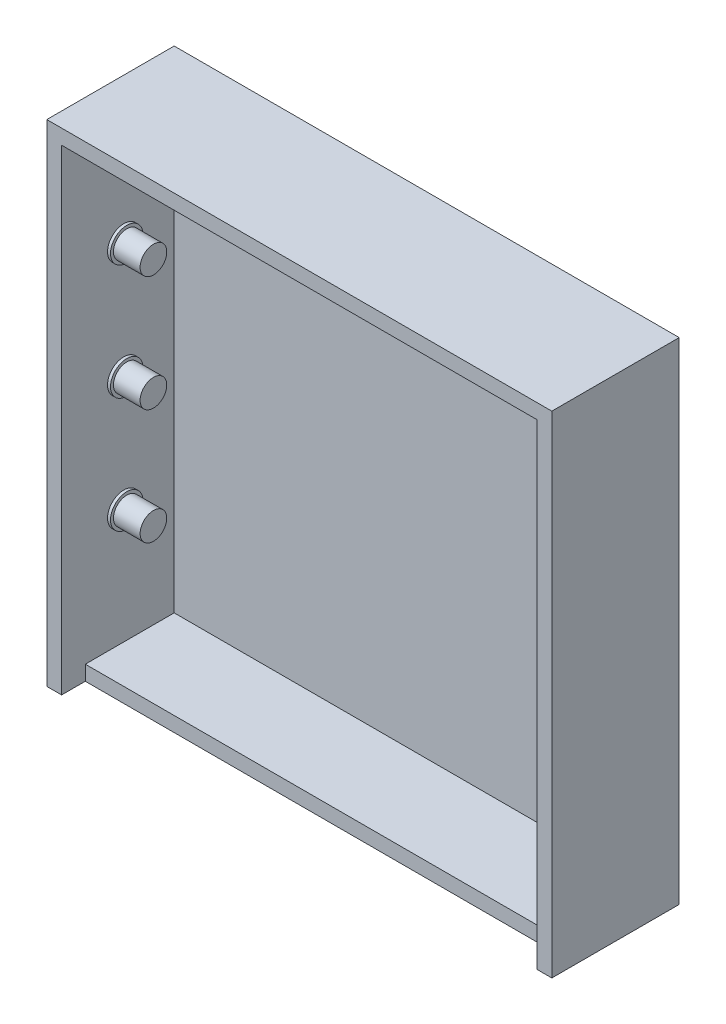
from build123d import *

# Parameters (mm, degrees)
SKETCH1_W               = 170.47
SKETCH1_H               = 165.71
BOSS_EXTRUDE1_DEPTH     = 5
SKETCH2_W               = 170.47
SKETCH2_H               = 165.71
SKETCH2_W_2             = 160.47
SKETCH2_H_2             = 155.71
BOSS_EXTRUDE2_DEPTH     = 38
SKETCH3_W               = 160.47
SKETCH3_H               = 5
CUT_EXTRUDE1_DEPTH      = 8
SKETCH5_R               = 5.5
BOSS_EXTRUDE3_DEPTH     = 1
SKETCH6_R               = 4.5
BOSS_EXTRUDE4_DEPTH     = 9
LPATTERN1_COUNT         = 3
LPATTERN1_PITCH         = 38.9275
MIRROR1_COPY_1_SKETCH_R = 5.5
MIRROR1_COPY_1_DEPTH    = 1
MIRROR1_COPY_2_SKETCH_R = 5.5
MIRROR1_COPY_2_DEPTH    = 1
MIRROR1_COPY_3_SKETCH_R = 4.5
MIRROR1_COPY_3_DEPTH    = 9
MIRROR1_COPY_4_SKETCH_R = 4.5
MIRROR1_COPY_4_DEPTH    = 9
MIRROR1_COPY_5_SKETCH_R = 5.5
MIRROR1_COPY_5_DEPTH    = 1
MIRROR1_COPY_6_SKETCH_R = 4.5
MIRROR1_COPY_6_DEPTH    = 9


with BuildPart() as part:
    # Sketch1 → Boss-Extrude1 (new body)
    with BuildSketch(Plane.XY):
        with Locations((85.235, 82.855)):
            Rectangle(SKETCH1_W, SKETCH1_H)
    extrude(amount=BOSS_EXTRUDE1_DEPTH)

    # Sketch2 → Boss-Extrude2 (add)
    with BuildSketch(Plane.XY.offset(5)):
        with Locations((85.235, 82.855)):
            Rectangle(SKETCH2_W, SKETCH2_H)
        with Locations((85.235, 82.855)):
            Rectangle(SKETCH2_W_2, SKETCH2_H_2, mode=Mode.SUBTRACT)
    extrude(amount=BOSS_EXTRUDE2_DEPTH)

    # Sketch3 → Cut-Extrude1 (cut)
    with BuildSketch(Plane.XY.offset(43)):
        with Locations((85.235, 2.5)):
            Rectangle(SKETCH3_W, SKETCH3_H)
    extrude(amount=-CUT_EXTRUDE1_DEPTH, mode=Mode.SUBTRACT)

    # Sketch5 → Boss-Extrude3 (add)
    with BuildSketch(Plane.ZY.offset(-165.47)):
        with Locations((22, 121.7825)):
            Circle(SKETCH5_R)
    boss_extrude3 = extrude(amount=BOSS_EXTRUDE3_DEPTH)

    # Sketch6 → Boss-Extrude4 (add)
    with BuildSketch(Plane.ZY.offset(-164.47)):
        with Locations((22, 121.7825)):
            Circle(SKETCH6_R)
    boss_extrude4 = extrude(amount=BOSS_EXTRUDE4_DEPTH)

    # LPattern1: Boss-Extrude3, Boss-Extrude4 ×3
    with Locations(*[(0, -i * LPATTERN1_PITCH, 0) for i in range(1, LPATTERN1_COUNT)]):
        add(boss_extrude3)
        add(boss_extrude4)

    # Mirror1 copy 1 sketch → Mirror1 copy 1 (add)
    with BuildSketch(Plane(origin=(5, -38.9275, 0), x_dir=(0, 0, 1), z_dir=(1, 0, 0))):
        with Locations((22, -121.7825)):
            Circle(MIRROR1_COPY_1_SKETCH_R)
    extrude(amount=MIRROR1_COPY_1_DEPTH)

    # Mirror1 copy 2 sketch → Mirror1 copy 2 (add)
    with BuildSketch(Plane(origin=(5, -77.855, 0), x_dir=(0, 0, 1), z_dir=(1, 0, 0))):
        with Locations((22, -121.7825)):
            Circle(MIRROR1_COPY_2_SKETCH_R)
    extrude(amount=MIRROR1_COPY_2_DEPTH)

    # Mirror1 copy 3 sketch → Mirror1 copy 3 (add)
    with BuildSketch(Plane(origin=(6, -38.9275, 0), x_dir=(0, 0, 1), z_dir=(1, 0, 0))):
        with Locations((22, -121.7825)):
            Circle(MIRROR1_COPY_3_SKETCH_R)
    extrude(amount=MIRROR1_COPY_3_DEPTH)

    # Mirror1 copy 4 sketch → Mirror1 copy 4 (add)
    with BuildSketch(Plane(origin=(6, -77.855, 0), x_dir=(0, 0, 1), z_dir=(1, 0, 0))):
        with Locations((22, -121.7825)):
            Circle(MIRROR1_COPY_4_SKETCH_R)
    extrude(amount=MIRROR1_COPY_4_DEPTH)

    # Mirror1 copy 5 sketch → Mirror1 copy 5 (add)
    with BuildSketch(Plane(origin=(5, 0, 0), x_dir=(0, 0, 1), z_dir=(1, 0, 0))):
        with Locations((22, -121.7825)):
            Circle(MIRROR1_COPY_5_SKETCH_R)
    extrude(amount=MIRROR1_COPY_5_DEPTH)

    # Mirror1 copy 6 sketch → Mirror1 copy 6 (add)
    with BuildSketch(Plane(origin=(6, 0, 0), x_dir=(0, 0, 1), z_dir=(1, 0, 0))):
        with Locations((22, -121.7825)):
            Circle(MIRROR1_COPY_6_SKETCH_R)
    extrude(amount=MIRROR1_COPY_6_DEPTH)


solid = part.part
